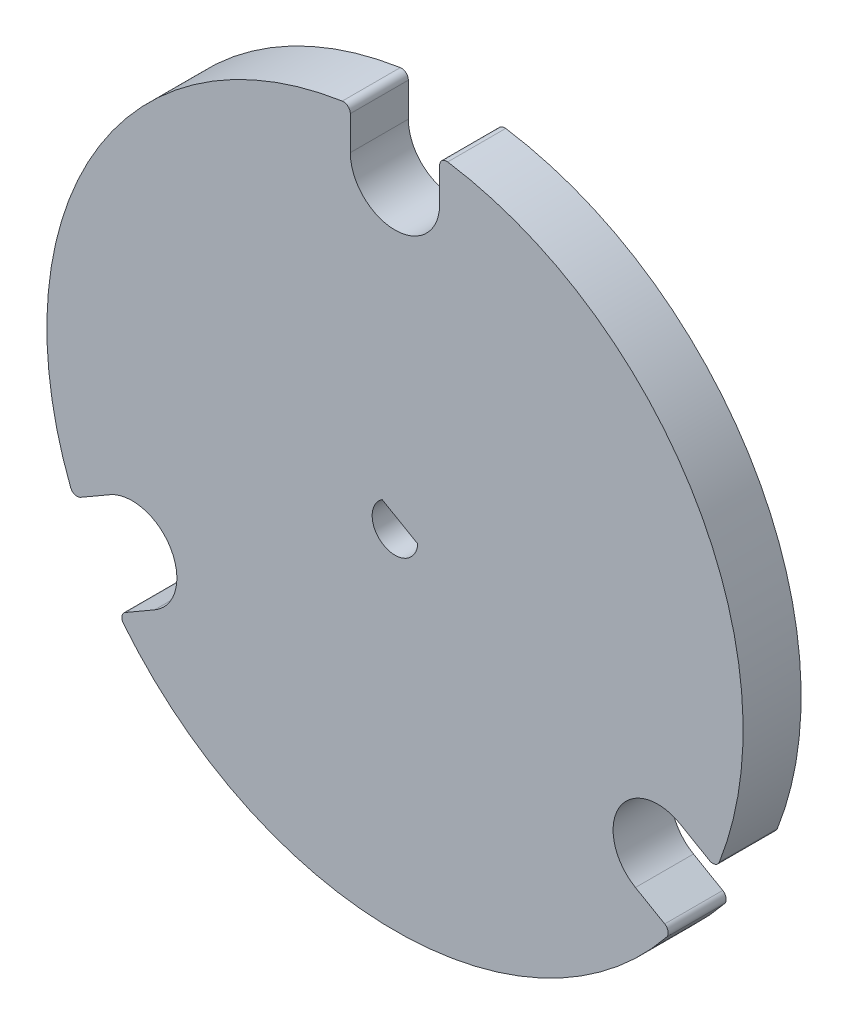
from build123d import *

# Parameters (mm, degrees)
SKETCH1_R           = 38.1
BOSS_EXTRUDE1_DEPTH = 6.35
CUT_EXTRUDE1_DEPTH  = 55.254423783
CUT_EXTRUDE2_DEPTH  = 55.254423783
FILLET1_R           = 0.762


with BuildPart() as part:
    # Sketch1 → Boss-Extrude1 (new body)
    with BuildSketch(Plane.XY):
        Circle(SKETCH1_R)
    extrude(amount=BOSS_EXTRUDE1_DEPTH)

    # Sketch2 → Cut-Extrude1 (cut, through all)
    with BuildSketch(Plane.XY.offset(6.35)):
        with BuildLine():
            Line((-4.8895, 33.2105), (-4.8895, 37.784954542))
            ThreePointArc((-4.8895, 37.784954542), (0, 38.1), (4.8895, 37.784954542))
            Line((4.8895, 37.784954542), (4.8895, 33.2105))
            ThreePointArc((4.8895, 33.2105), (0, 28.321), (-4.8895, 33.2105))
        make_face()
        with BuildLine():
            Line((31.205886672, -12.370818788), (35.167480514, -14.658046059))
            ThreePointArc((35.167480514, -14.658046059), (32.995567884, -19.05), (30.277980514, -23.126908483))
            Line((30.277980514, -23.126908483), (26.316386672, -20.839681212))
            ThreePointArc((26.316386672, -20.839681212), (24.526705461, -14.1605), (31.205886672, -12.370818788))
        make_face()
        with BuildLine():
            Line((-26.316386672, -20.839681212), (-30.277980514, -23.126908483))
            ThreePointArc((-30.277980514, -23.126908483), (-32.995567884, -19.05), (-35.167480514, -14.658046059))
            Line((-35.167480514, -14.658046059), (-31.205886672, -12.370818788))
            ThreePointArc((-31.205886672, -12.370818788), (-24.526705461, -14.1605), (-26.316386672, -20.839681212))
        make_face()
    extrude(amount=-CUT_EXTRUDE1_DEPTH, mode=Mode.SUBTRACT)

    # Sketch3 → Cut-Extrude2 (cut, through all)
    with BuildSketch(Plane.XY.offset(6.35)):
        with BuildLine():
            Line((2.493419526, -0.181270696), (-1.403694791, 2.068729304))
            ThreePointArc((-1.403694791, 2.068729304), (-1.25, -2.165063509), (2.493419526, -0.181270696))
        make_face()
    extrude(amount=-CUT_EXTRUDE2_DEPTH, mode=Mode.SUBTRACT)

    # Fillet1
    fillet1_edges = [part.edges().sort_by_distance(p)[0] for p in [
        (-4.8895, 37.784954542, 3.175),
        (4.8895, 37.784954542, 3.175),
        (-30.277980514, -23.126908483, 3.175),
        (-35.167480514, -14.658046059, 3.175),
        (30.277980514, -23.126908483, 3.175),
        (35.167480514, -14.658046059, 3.175),
    ]]
    fillet(fillet1_edges, radius=FILLET1_R)


solid = part.part
